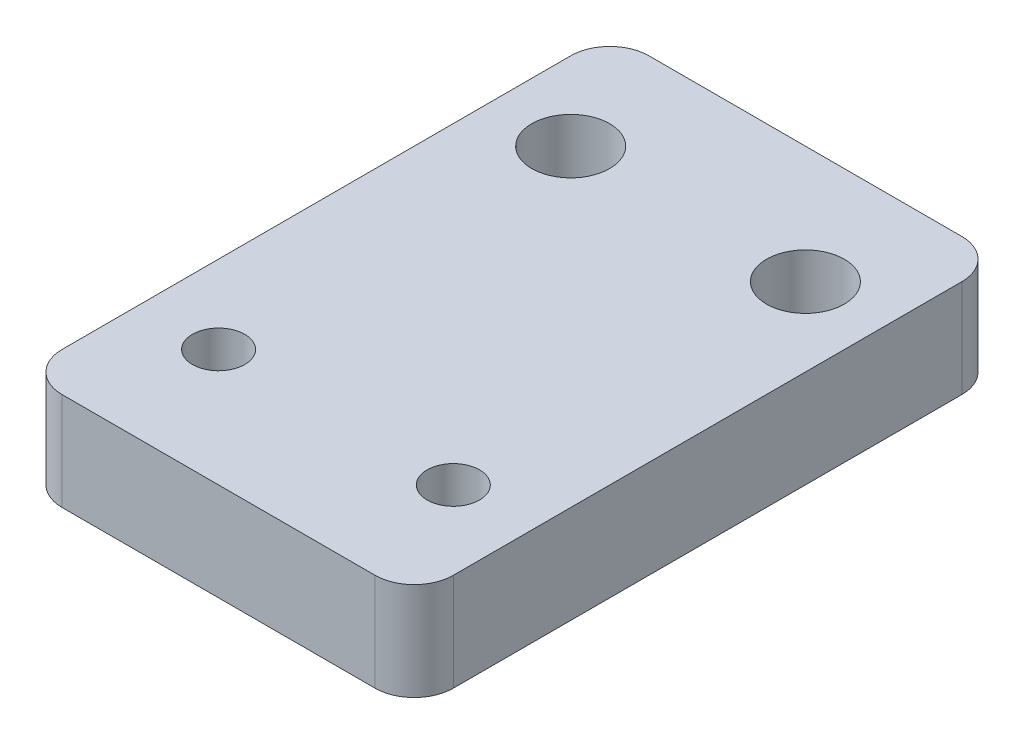
from build123d import *

# Parameters (mm, degrees)
SKETCH1_W           = 25.4
SKETCH1_H           = 38.1
SKETCH1_R           = 1.7
SKETCH1_R_2         = 2.5273
BOSS_EXTRUDE1_DEPTH = 6.35
FILLET1_R           = 2.54


with BuildPart() as part:
    # Sketch1 → Boss-Extrude1 (new body)
    with BuildSketch(Plane(origin=(0, 0, 0), x_dir=(1, 0, 0), z_dir=(0, 1, 0))):
        Rectangle(SKETCH1_W, SKETCH1_H)
        with Locations((-7.62, -11.43)):
            Circle(SKETCH1_R, mode=Mode.SUBTRACT)
        with Locations((7.62, -11.43)):
            Circle(SKETCH1_R, mode=Mode.SUBTRACT)
        with Locations((-7.62, 11.43)):
            Circle(SKETCH1_R_2, mode=Mode.SUBTRACT)
        with Locations((7.62, 11.43)):
            Circle(SKETCH1_R_2, mode=Mode.SUBTRACT)
    extrude(amount=BOSS_EXTRUDE1_DEPTH)

    # Fillet1
    fillet1_edges = [part.edges().sort_by_distance(p)[0] for p in [
        (12.7, 3.175, 19.05),
        (-12.7, 3.175, -19.05),
        (12.7, 3.175, -19.05),
        (-12.7, 3.175, 19.05),
    ]]
    fillet(fillet1_edges, radius=FILLET1_R)


solid = part.part
